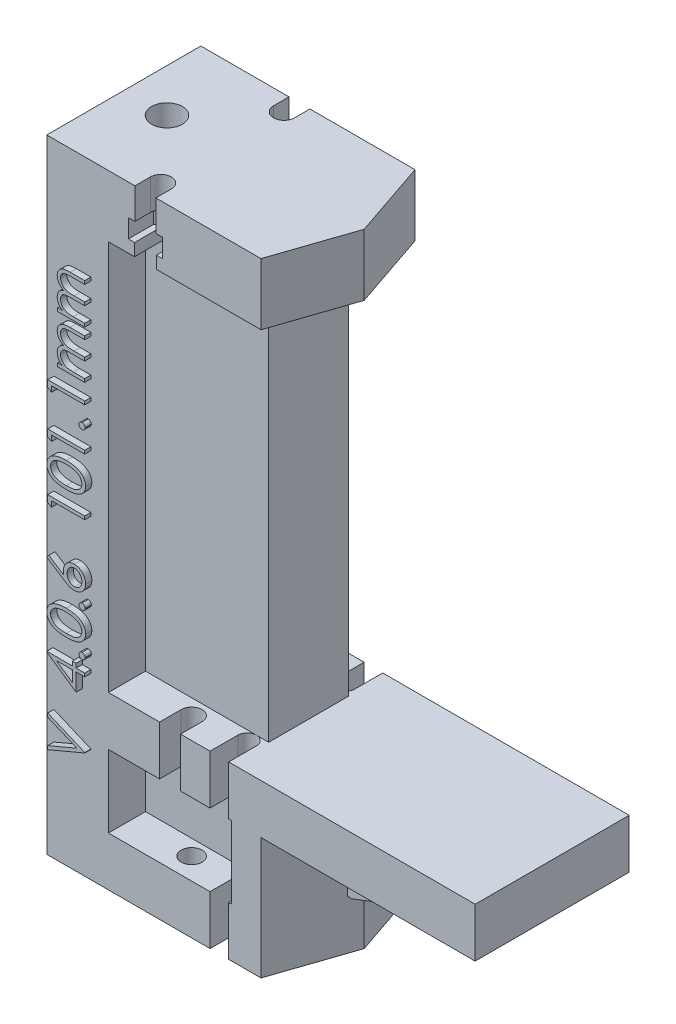
from build123d import *
from build123d.topology import SkipClean

# Parameters (mm, degrees)
BOSS_EXTRUDE2_DEPTH              = 12.5
BOSS_EXTRUDE3_DEPTH              = 25
CUT_EXTRUDE2_REACH               = 106.893
CUT_EXTRUDE3_REACH               = 106.893
CUT_EXTRUDE6_REACH               = 106.893
SKETCH30_W                       = 10
SKETCH30_H                       = 25
CUT_EXTRUDE8_DEPTH               = 8
CUT_EXTRUDE9_DEPTH               = 79.499719904
CUT_EXTRUDE9_DEPTH_BACK          = 79.499719904
BOSS_EXTRUDE6_DEPTH              = 1
BOSS_EXTRUDE7_DEPTH              = 40
BOSS_EXTRUDE17_DEPTH             = 2
CUT_EXTRUDE10_DEPTH              = 3
SKETCH39_W                       = 4
SKETCH39_H                       = 11.745
BOSS_EXTRUDE18_DEPTH             = 2.5
F_5_0MM_DOWEL_HOLE1_D            = 5
F_5_0MM_DOWEL_HOLE1_DEPTH        = 5
F_5_0MM_DOWEL_HOLE1_TIP          = 1.502151548
BOSS_EXTRUDE19_DEPTH             = 2
BOSS_EXTRUDE20_DEPTH             = 8
BOSS_EXTRUDE21_REACH             = 88.858
SKETCH45_W                       = 20
SKETCH45_H                       = 12.98
BOSS_EXTRUDE21_DIRECTION_2_REACH = 88.858


with BuildPart() as part:
    # Sketch6 → Boss-Extrude2 (new, symmetric)
    with BuildSketch(Plane.XY):
        Polygon((-25, 50.55), (15, 50.55), (15, 42.55), (-15, 42.55), (-15, -42.55), (25, -42.55), (25, -50.55), (-25, -50.55), align=None)
    extrude(amount=BOSS_EXTRUDE2_DEPTH, both=True)

    # Sketch15 → Boss-Extrude3 (add)
    with BuildSketch(Plane.XY.offset(12.5)):
        Polygon((-15, -22.805), (15, -22.805), (15, -50.55), (5, -50.55), (5, -30.805), (-15, -30.805), align=None)
    extrude(amount=-BOSS_EXTRUDE3_DEPTH)

    # Sketch20 → Cut-Extrude2 (cut, up to next)
    with BuildSketch(Plane(origin=(0, 50.55, 0), x_dir=(1, 0, 0), z_dir=(0, 1, 0)), mode=Mode.PRIVATE) as cut_extrude2_sk1:
        with BuildLine():
            Line((-10.7, 12.5), (-10.7, 10))
            ThreePointArc((-10.7, 10), (-9, 8.3), (-7.3, 10))
            Line((-7.3, 10), (-7.3, 12.5))
            Line((-7.3, 12.5), (-10.7, 12.5))
        make_face()
    cut_extrude2_tool1 = extrude(cut_extrude2_sk1.sketch, amount=-CUT_EXTRUDE2_REACH, mode=Mode.PRIVATE) & part.part
    # Sketch20 → Cut-Extrude2 (cut, up to next)
    with BuildSketch(Plane(origin=(0, 50.55, 0), x_dir=(1, 0, 0), z_dir=(0, 1, 0)), mode=Mode.PRIVATE) as cut_extrude2_sk2:
        with BuildLine():
            Line((-7.3, -12.5), (-10.7, -12.5))
            Line((-10.7, -12.5), (-10.7, -10))
            ThreePointArc((-10.7, -10), (-9, -8.3), (-7.3, -10))
            Line((-7.3, -10), (-7.3, -12.5))
        make_face()
    cut_extrude2_tool2 = extrude(cut_extrude2_sk2.sketch, amount=-CUT_EXTRUDE2_REACH, mode=Mode.PRIVATE) & part.part
    add(cut_extrude2_tool1.solids().sort_by_distance((-9, 50.55, -10.563642))[0], mode=Mode.SUBTRACT)
    add(cut_extrude2_tool2.solids().sort_by_distance((-9, 50.55, 10.563642))[0], mode=Mode.SUBTRACT)

    # Cut-Extrude3: up to this face of the body (flat: up to its plane)
    cut_extrude3_end = Plane(part.part.faces().sort_by_distance((0, -22.805, 0))[0])
    # Sketch21 → Cut-Extrude3 (cut, up to the picked face)
    with BuildSketch(Plane.XZ.offset(50.55), mode=Mode.PRIVATE) as cut_extrude3_sk1:
        with BuildLine():
            Line((-6.7, 12.5), (-6.7, 9))
            ThreePointArc((-6.7, 9), (-5, 7.3), (-3.3, 9))
            Line((-3.3, 9), (-3.3, 12.5))
            Line((-3.3, 12.5), (-6.7, 12.5))
        make_face()
    cut_extrude3_tool1 = split(extrude(cut_extrude3_sk1.sketch, amount=-CUT_EXTRUDE3_REACH, mode=Mode.PRIVATE), bisect_by=cut_extrude3_end, keep=Keep.BOTH, mode=Mode.PRIVATE)
    # Sketch21 → Cut-Extrude3 (cut, up to the picked face)
    with BuildSketch(Plane.XZ.offset(50.55), mode=Mode.PRIVATE) as cut_extrude3_sk2:
        with BuildLine():
            Line((-3.3, -12.5), (-6.7, -12.5))
            Line((-6.7, -12.5), (-6.7, -9))
            ThreePointArc((-6.7, -9), (-5, -7.3), (-3.3, -9))
            Line((-3.3, -9), (-3.3, -12.5))
        make_face()
    cut_extrude3_tool2 = split(extrude(cut_extrude3_sk2.sketch, amount=-CUT_EXTRUDE3_REACH, mode=Mode.PRIVATE), bisect_by=cut_extrude3_end, keep=Keep.BOTH, mode=Mode.PRIVATE)
    add(cut_extrude3_tool1.solids().sort_by(Axis((-5, -50.55, 10.067524), (0, 1, 0)))[0], mode=Mode.SUBTRACT)
    add(cut_extrude3_tool2.solids().sort_by(Axis((-5, -50.55, -10.067524), (0, 1, 0)))[0], mode=Mode.SUBTRACT)

    # Cut-Extrude6: up to this face of the body (flat: up to its plane)
    cut_extrude6_end = Plane(part.part.faces().sort_by_distance((0.229244521, -22.805, 0))[0])
    # Sketch24 → Cut-Extrude6 (cut, up to the picked face)
    with BuildSketch(Plane.XZ.offset(50.55), mode=Mode.PRIVATE) as cut_extrude6_sk1:
        with BuildLine():
            Line((1.49, -12.5), (1.49, -8))
            ThreePointArc((1.49, -8), (3, -6.49), (4.51, -8))
            Line((4.51, -8), (4.51, -12.5))
            Line((4.51, -12.5), (1.49, -12.5))
        make_face()
    cut_extrude6_tool1 = split(extrude(cut_extrude6_sk1.sketch, amount=-CUT_EXTRUDE6_REACH, mode=Mode.PRIVATE), bisect_by=cut_extrude6_end, keep=Keep.BOTH, mode=Mode.PRIVATE)
    # Sketch24 → Cut-Extrude6 (cut, up to the picked face)
    with BuildSketch(Plane.XZ.offset(50.55), mode=Mode.PRIVATE) as cut_extrude6_sk2:
        with BuildLine():
            Line((4.51, 12.5), (1.49, 12.5))
            Line((1.49, 12.5), (1.49, 8))
            ThreePointArc((1.49, 8), (3, 6.49), (4.51, 8))
            Line((4.51, 8), (4.51, 12.5))
        make_face()
    cut_extrude6_tool2 = split(extrude(cut_extrude6_sk2.sketch, amount=-CUT_EXTRUDE6_REACH, mode=Mode.PRIVATE), bisect_by=cut_extrude6_end, keep=Keep.BOTH, mode=Mode.PRIVATE)
    add(cut_extrude6_tool1.solids().sort_by(Axis((3, -50.55, -9.647036), (0, 1, 0)))[0], mode=Mode.SUBTRACT)
    add(cut_extrude6_tool2.solids().sort_by(Axis((3, -50.55, 9.647036), (0, 1, 0)))[0], mode=Mode.SUBTRACT)

    # Sketch30 → Cut-Extrude8 (cut)
    with BuildSketch(Plane(origin=(0, -42.55, 0), x_dir=(1, 0, 0), z_dir=(0, 1, 0))):
        with Locations((20, 0)):
            Rectangle(SKETCH30_W, SKETCH30_H)
    extrude(amount=-CUT_EXTRUDE8_DEPTH, mode=Mode.SUBTRACT)

    # Sketch34 → Cut-Extrude9 (cut, two sides: drawn at the far end of the back side and taken through both)
    with BuildSketch(Plane(origin=(0, -22.805, 0), x_dir=(1, 0, 0), z_dir=(0, 1, 0)).offset(-CUT_EXTRUDE9_DEPTH_BACK)):
        Polygon((9.755, 12.5), (14, 0), (9.755, -12.5), (15, -12.5), (15, 12.5), align=None)
    extrude(amount=CUT_EXTRUDE9_DEPTH + CUT_EXTRUDE9_DEPTH_BACK, mode=Mode.SUBTRACT)

    # Sketch35 → Boss-Extrude6 (add)
    # profile 1 of 13: a face of its own
    with BuildSketch(Plane.XY.offset(12.5)):
        with BuildLine():
            Line((-22.234615385, 27.615384615), (-22.234615385, 28.153846154))
            Line((-22.234615385, 28.153846154), (-21.472596154, 28.153846154))
            add(Edge.make_bspline(
                [(-21.472596154, 28.153846154), (-21.539260614, 28.202332925), (-21.666996111, 28.295238227), (-21.835322312, 28.447579346), (-21.978170577, 28.599766967), (-22.053158357, 28.70936705), (-22.089182692, 28.762019231)],
                knots=[0, 0, 0, 0, 1.134379233, 2.173579362, 3.122582517, 4, 4, 4, 4], degree=3))
            add(Edge.make_bspline(
                [(-22.089182692, 28.762019231), (-22.123477604, 28.833787223), (-22.191468256, 28.976069337), (-22.260440071, 29.201359437), (-22.302825959, 29.431887442), (-22.308622599, 29.587558666), (-22.311538462, 29.665865385)],
                knots=[0, 0, 0, 0, 1.014936303, 2.012140481, 3.000054389, 4, 4, 4, 4], degree=3))
            add(Edge.make_bspline(
                [(-22.311538462, 29.665865385), (-22.309746507, 29.718824779), (-22.306200324, 29.823628574), (-22.283126386, 29.978915994), (-22.243239974, 30.129529211), (-22.187690322, 30.274587601), (-22.120389321, 30.411230628), (-22.041520642, 30.536600172), (-21.952811526, 30.648610476), (-21.851715073, 30.749056719), (-21.732621113, 30.83858538), (-21.593245652, 30.920361942), (-21.431579845, 30.996927786), (-21.314358593, 31.039096955), (-21.252644231, 31.061298077)],
                knots=[0, 0, 0, 0, 1.009731074, 1.9982035, 2.985760524, 3.974587072, 4.955028184, 5.885388378, 6.793242796, 7.673688873, 8.594941726, 9.625945874, 10.750113716, 12, 12, 12, 12], degree=3))
            add(Edge.make_bspline(
                [(-21.252644231, 31.061298077), (-21.295028488, 31.084803509), (-21.378434755, 31.131058898), (-21.496484081, 31.208719564), (-21.60687165, 31.290115359), (-21.709826129, 31.375808349), (-21.80452798, 31.466158417), (-21.892909205, 31.559709831), (-21.972522012, 31.65855761), (-22.065676161, 31.795282971), (-22.164941217, 31.97298822), (-22.248837086, 32.197914933), (-22.302266055, 32.431002803), (-22.308427236, 32.589456464), (-22.311538462, 32.669471154)],
                knots=[0, 0, 0, 0, 0.861026002, 1.694378253, 2.508904292, 3.297437177, 4.073006284, 4.833627155, 5.583069468, 6.325614666, 7.772320565, 9.187282923, 10.579656144, 12, 12, 12, 12], degree=3))
            add(Edge.make_bspline(
                [(-22.311538462, 32.669471154), (-22.308800813, 32.742995007), (-22.30344297, 32.886888326), (-22.260375554, 33.096018305), (-22.189095041, 33.291888325), (-22.088852441, 33.472422361), (-21.963482389, 33.635522594), (-21.814139706, 33.777834074), (-21.641369838, 33.896227786), (-21.480136821, 33.975377221), (-21.337524673, 34.028068152), (-21.215460368, 34.060975775), (-21.081004779, 34.089485755), (-20.934266049, 34.113657918), (-20.774947077, 34.131133284), (-20.602974661, 34.144124267), (-20.418199364, 34.152904699), (-20.290715767, 34.153525923), (-20.225, 34.153846154)],
                knots=[0, 0, 0, 0, 1.209392158, 2.366897878, 3.497663982, 4.628180075, 5.751982922, 6.871462727, 8.009245026, 9.185977379, 9.818124946, 10.509294143, 11.264649411, 12.079922034, 12.956003306, 13.901808055, 14.918415426, 16, 16, 16, 16], degree=3))
            Line((-20.225, 34.153846154), (-17.85, 34.153846154))
            Line((-17.85, 34.153846154), (-17.85, 33.615384615))
            Line((-17.85, 33.615384615), (-20.227403846, 33.615384615))
            add(Edge.make_bspline(
                [(-20.227403846, 33.615384615), (-20.283496341, 33.61525175), (-20.391297586, 33.614996403), (-20.546014988, 33.610370226), (-20.687050044, 33.60169783), (-20.814586843, 33.591401636), (-20.928585361, 33.577484141), (-21.028726359, 33.559108709), (-21.115466742, 33.539796341), (-21.211587244, 33.507636113), (-21.317531947, 33.456700435), (-21.430954892, 33.377701419), (-21.530458078, 33.279661851), (-21.616841526, 33.165831979), (-21.687129696, 33.036339747), (-21.737313417, 32.893594816), (-21.768382244, 32.738515088), (-21.771478124, 32.631161524), (-21.773076923, 32.575721154)],
                knots=[0, 0, 0, 0, 1.253367865, 2.408782419, 3.458086102, 4.410454771, 5.267690823, 6.022776742, 6.685072793, 7.251272234, 8.28433411, 9.300106008, 10.325693114, 11.39283262, 12.482417211, 13.60372085, 14.762494729, 16, 16, 16, 16], degree=3))
            add(Edge.make_bspline(
                [(-21.773076923, 32.575721154), (-21.76997183, 32.50777098), (-21.763840459, 32.373595416), (-21.717743069, 32.176588739), (-21.641126709, 31.989288216), (-21.536341225, 31.812958398), (-21.407618816, 31.652246316), (-21.255294615, 31.513477382), (-21.082742522, 31.3989302), (-20.92307314, 31.321348132), (-20.779638783, 31.272334455), (-20.654327211, 31.239989762), (-20.511520556, 31.214678274), (-20.352893327, 31.191399346), (-20.177094809, 31.175688837), (-19.985210505, 31.161810327), (-19.775926859, 31.155231794), (-19.63085208, 31.15431971), (-19.555528846, 31.153846154)],
                knots=[0, 0, 0, 0, 1.091136677, 2.154576964, 3.231646693, 4.331257757, 5.439166191, 6.528231045, 7.628049365, 8.756709726, 9.369482423, 10.061167346, 10.833871401, 11.698739631, 12.636505159, 13.668922441, 14.789697963, 16, 16, 16, 16], degree=3))
            Line((-19.555528846, 31.153846154), (-17.85, 31.153846154))
            Line((-17.85, 31.153846154), (-17.85, 30.615384615))
            Line((-17.85, 30.615384615), (-20.079567308, 30.615384615))
            add(Edge.make_bspline(
                [(-20.079567308, 30.615384615), (-20.14247014, 30.615248448), (-20.263488866, 30.614986475), (-20.437032312, 30.610398505), (-20.594885583, 30.601678575), (-20.736865264, 30.591597658), (-20.862713168, 30.577094421), (-20.973104451, 30.56062077), (-21.067760922, 30.54116532), (-21.17158701, 30.508956742), (-21.285945136, 30.459714552), (-21.407983755, 30.380604381), (-21.514604324, 30.281417491), (-21.607034555, 30.166349159), (-21.682563185, 30.035870107), (-21.73505501, 29.891423368), (-21.767080197, 29.735375076), (-21.771040318, 29.627561566), (-21.773076923, 29.572115385)],
                knots=[0, 0, 0, 0, 1.320285835, 2.540097241, 3.643286278, 4.638464947, 5.527188413, 6.301437306, 6.980978976, 7.552872752, 8.580906713, 9.583871393, 10.589652407, 11.624542289, 12.671761011, 13.738681301, 14.837052193, 16, 16, 16, 16], degree=3))
            add(Edge.make_bspline(
                [(-21.773076923, 29.572115385), (-21.770453269, 29.506944753), (-21.765224419, 29.377061998), (-21.718160076, 29.186258376), (-21.644438314, 29.001998159), (-21.542166243, 28.827214974), (-21.415474903, 28.666644721), (-21.266504635, 28.526007243), (-21.097243672, 28.408221402), (-20.939930706, 28.329292274), (-20.800047184, 28.278690912), (-20.680645905, 28.245515012), (-20.548314964, 28.216395158), (-20.402780158, 28.194994017), (-20.24469108, 28.174269247), (-20.073236398, 28.164279089), (-19.888570334, 28.154555048), (-19.761074488, 28.154088248), (-19.694951923, 28.153846154)],
                knots=[0, 0, 0, 0, 1.09880202, 2.189873405, 3.297736452, 4.440485332, 5.596193377, 6.739822772, 7.886349079, 9.066114917, 9.699498033, 10.395421758, 11.156987371, 11.985484089, 12.878178647, 13.847820956, 14.883825601, 16, 16, 16, 16], degree=3))
            Line((-19.694951923, 28.153846154), (-17.85, 28.153846154))
            Line((-17.85, 28.153846154), (-17.85, 27.615384615))
            Line((-17.85, 27.615384615), (-22.234615385, 27.615384615))
        make_face()
    # profile 2 of 13: a face of its own
    with BuildSketch(Plane.XY.offset(12.5)):
        with BuildLine():
            Line((-22.234615385, 19.846153846), (-22.234615385, 20.384615385))
            Line((-22.234615385, 20.384615385), (-21.472596154, 20.384615385))
            add(Edge.make_bspline(
                [(-21.472596154, 20.384615385), (-21.539260614, 20.433102156), (-21.666996111, 20.526007458), (-21.835322312, 20.678348577), (-21.978170577, 20.830536198), (-22.053158357, 20.940136281), (-22.089182692, 20.992788462)],
                knots=[0, 0, 0, 0, 1.134379233, 2.173579362, 3.122582517, 4, 4, 4, 4], degree=3))
            add(Edge.make_bspline(
                [(-22.089182692, 20.992788462), (-22.123477604, 21.064556454), (-22.191468256, 21.206838568), (-22.260440071, 21.432128668), (-22.302825959, 21.662656672), (-22.308622599, 21.818327896), (-22.311538462, 21.896634615)],
                knots=[0, 0, 0, 0, 1.014936303, 2.012140481, 3.000054389, 4, 4, 4, 4], degree=3))
            add(Edge.make_bspline(
                [(-22.311538462, 21.896634615), (-22.309746507, 21.94959401), (-22.306200324, 22.054397804), (-22.283126386, 22.209685225), (-22.243239974, 22.360298442), (-22.187690322, 22.505356831), (-22.120389321, 22.641999859), (-22.041520642, 22.767369402), (-21.952811526, 22.879379707), (-21.851715073, 22.97982595), (-21.732621113, 23.069354611), (-21.593245652, 23.151131173), (-21.431579845, 23.227697017), (-21.314358593, 23.269866186), (-21.252644231, 23.292067308)],
                knots=[0, 0, 0, 0, 1.009731074, 1.9982035, 2.985760524, 3.974587072, 4.955028184, 5.885388378, 6.793242796, 7.673688873, 8.594941726, 9.625945874, 10.750113716, 12, 12, 12, 12], degree=3))
            add(Edge.make_bspline(
                [(-21.252644231, 23.292067308), (-21.295028488, 23.31557274), (-21.378434755, 23.361828129), (-21.496484081, 23.439488795), (-21.60687165, 23.52088459), (-21.709826129, 23.60657758), (-21.80452798, 23.696927648), (-21.892909205, 23.790479062), (-21.972522012, 23.889326841), (-22.065676161, 24.026052201), (-22.164941217, 24.20375745), (-22.248837086, 24.428684164), (-22.302266055, 24.661772034), (-22.308427236, 24.820225695), (-22.311538462, 24.900240385)],
                knots=[0, 0, 0, 0, 0.861026002, 1.694378253, 2.508904292, 3.297437177, 4.073006284, 4.833627155, 5.583069468, 6.325614666, 7.772320565, 9.187282923, 10.579656144, 12, 12, 12, 12], degree=3))
            add(Edge.make_bspline(
                [(-22.311538462, 24.900240385), (-22.308800813, 24.973764238), (-22.30344297, 25.117657557), (-22.260375554, 25.326787536), (-22.189095041, 25.522657555), (-22.088852441, 25.703191592), (-21.963482389, 25.866291825), (-21.814139706, 26.008603304), (-21.641369838, 26.126997017), (-21.480136821, 26.206146451), (-21.337524673, 26.258837383), (-21.215460368, 26.291745005), (-21.081004779, 26.320254985), (-20.934266049, 26.344427149), (-20.774947077, 26.361902515), (-20.602974661, 26.374893498), (-20.418199364, 26.38367393), (-20.290715767, 26.384295154), (-20.225, 26.384615385)],
                knots=[0, 0, 0, 0, 1.209392158, 2.366897878, 3.497663982, 4.628180075, 5.751982922, 6.871462727, 8.009245026, 9.185977379, 9.818124946, 10.509294143, 11.264649411, 12.079922034, 12.956003306, 13.901808055, 14.918415426, 16, 16, 16, 16], degree=3))
            Line((-20.225, 26.384615385), (-17.85, 26.384615385))
            Line((-17.85, 26.384615385), (-17.85, 25.846153846))
            Line((-17.85, 25.846153846), (-20.227403846, 25.846153846))
            add(Edge.make_bspline(
                [(-20.227403846, 25.846153846), (-20.283496341, 25.846020981), (-20.391297586, 25.845765633), (-20.546014988, 25.841139457), (-20.687050044, 25.832467061), (-20.814586843, 25.822170867), (-20.928585361, 25.808253372), (-21.028726359, 25.78987794), (-21.115466742, 25.770565572), (-21.211587244, 25.738405344), (-21.317531947, 25.687469666), (-21.430954892, 25.608470649), (-21.530458078, 25.510431082), (-21.616841526, 25.396601209), (-21.687129696, 25.267108977), (-21.737313417, 25.124364047), (-21.768382244, 24.969284319), (-21.771478124, 24.861930754), (-21.773076923, 24.806490385)],
                knots=[0, 0, 0, 0, 1.253367865, 2.408782419, 3.458086102, 4.410454771, 5.267690823, 6.022776742, 6.685072793, 7.251272234, 8.28433411, 9.300106008, 10.325693114, 11.39283262, 12.482417211, 13.60372085, 14.762494729, 16, 16, 16, 16], degree=3))
            add(Edge.make_bspline(
                [(-21.773076923, 24.806490385), (-21.76997183, 24.738540211), (-21.763840459, 24.604364647), (-21.717743069, 24.40735797), (-21.641126709, 24.220057447), (-21.536341225, 24.043727629), (-21.407618816, 23.883015547), (-21.255294615, 23.744246613), (-21.082742522, 23.62969943), (-20.92307314, 23.552117362), (-20.779638783, 23.503103686), (-20.654327211, 23.470758993), (-20.511520556, 23.445447505), (-20.352893327, 23.422168577), (-20.177094809, 23.406458068), (-19.985210505, 23.392579558), (-19.775926859, 23.386001025), (-19.63085208, 23.385088941), (-19.555528846, 23.384615385)],
                knots=[0, 0, 0, 0, 1.091136677, 2.154576964, 3.231646693, 4.331257757, 5.439166191, 6.528231045, 7.628049365, 8.756709726, 9.369482423, 10.061167346, 10.833871401, 11.698739631, 12.636505159, 13.668922441, 14.789697963, 16, 16, 16, 16], degree=3))
            Line((-19.555528846, 23.384615385), (-17.85, 23.384615385))
            Line((-17.85, 23.384615385), (-17.85, 22.846153846))
            Line((-17.85, 22.846153846), (-20.079567308, 22.846153846))
            add(Edge.make_bspline(
                [(-20.079567308, 22.846153846), (-20.14247014, 22.846017679), (-20.263488866, 22.845755706), (-20.437032312, 22.841167736), (-20.594885583, 22.832447805), (-20.736865264, 22.822366889), (-20.862713168, 22.807863652), (-20.973104451, 22.791390001), (-21.067760922, 22.771934551), (-21.17158701, 22.739725972), (-21.285945136, 22.690483782), (-21.407983755, 22.611373611), (-21.514604324, 22.512186722), (-21.607034555, 22.39711839), (-21.682563185, 22.266639338), (-21.73505501, 22.122192599), (-21.767080197, 21.966144307), (-21.771040318, 21.858330796), (-21.773076923, 21.802884615)],
                knots=[0, 0, 0, 0, 1.320285835, 2.540097241, 3.643286278, 4.638464947, 5.527188413, 6.301437306, 6.980978976, 7.552872752, 8.580906713, 9.583871393, 10.589652407, 11.624542289, 12.671761011, 13.738681301, 14.837052193, 16, 16, 16, 16], degree=3))
            add(Edge.make_bspline(
                [(-21.773076923, 21.802884615), (-21.770453269, 21.737713984), (-21.765224419, 21.607831229), (-21.718160076, 21.417027607), (-21.644438314, 21.232767389), (-21.542166243, 21.057984205), (-21.415474903, 20.897413952), (-21.266504635, 20.756776474), (-21.097243672, 20.638990632), (-20.939930706, 20.560061505), (-20.800047184, 20.509460143), (-20.680645905, 20.476284243), (-20.548314964, 20.447164389), (-20.402780158, 20.425763248), (-20.24469108, 20.405038478), (-20.073236398, 20.39504832), (-19.888570334, 20.385324279), (-19.761074488, 20.384857479), (-19.694951923, 20.384615385)],
                knots=[0, 0, 0, 0, 1.09880202, 2.189873405, 3.297736452, 4.440485332, 5.596193377, 6.739822772, 7.886349079, 9.066114917, 9.699498033, 10.395421758, 11.156987371, 11.985484089, 12.878178647, 13.847820956, 14.883825601, 16, 16, 16, 16], degree=3))
            Line((-19.694951923, 20.384615385), (-17.85, 20.384615385))
            Line((-17.85, 20.384615385), (-17.85, 19.846153846))
            Line((-17.85, 19.846153846), (-22.234615385, 19.846153846))
        make_face()
    # profile 3 of 13: a face of its own
    with BuildSketch(Plane.XY.offset(12.5)):
        Polygon((-23.85, 16.121394231), (-23.85, 17.230769231), (-17.85, 17.230769231), (-17.85, 16.692307692), (-23.234615385, 16.692307692), (-23.234615385, 15.769230769), align=None)
    # profile 4 of 13: a face of its own
    with BuildSketch(Plane.XY.offset(12.5)):
        with BuildLine():
            add(Edge.make_bspline(
                [(-18.773076923, 13.5), (-18.771091494, 13.533411792), (-18.767199294, 13.598911705), (-18.740496425, 13.693607354), (-18.693081578, 13.779312484), (-18.629888244, 13.855653476), (-18.553267107, 13.918578864), (-18.468245549, 13.967683467), (-18.372757105, 13.994153728), (-18.306877662, 13.998017577), (-18.273076923, 14)],
                knots=[0, 0, 0, 0, 1.020151414, 1.999887582, 2.974338812, 3.990962822, 5.007586832, 5.987933904, 6.967670073, 8, 8, 8, 8], degree=3))
            add(Edge.make_bspline(
                [(-18.273076923, 14), (-18.240082695, 13.997956712), (-18.17501856, 13.993927377), (-18.080332316, 13.967671525), (-17.995213248, 13.918638474), (-17.918771705, 13.855253112), (-17.854052036, 13.779769027), (-17.807265803, 13.693339216), (-17.778559122, 13.599151168), (-17.774926676, 13.53345467), (-17.773076923, 13.5)],
                knots=[0, 0, 0, 0, 1.009624703, 1.990965087, 2.972917375, 3.991206001, 5.017354006, 5.993400798, 6.978178195, 8, 8, 8, 8], degree=3))
            add(Edge.make_bspline(
                [(-17.773076923, 13.5), (-17.774859529, 13.466521236), (-17.778339643, 13.40116192), (-17.807852551, 13.307325026), (-17.853605582, 13.220368422), (-17.918889524, 13.144903952), (-17.994817845, 13.081004939), (-18.080918523, 13.034147269), (-18.174747202, 13.005614924), (-18.240029244, 13.001887122), (-18.273076923, 13)],
                knots=[0, 0, 0, 0, 1.022258411, 1.995716197, 2.98297171, 4.009558169, 5.028281891, 6.00474573, 6.989943903, 8, 8, 8, 8], degree=3))
            add(Edge.make_bspline(
                [(-18.273076923, 13), (-18.306933002, 13.001820742), (-18.373032842, 13.005375516), (-18.467659884, 13.034133791), (-18.553662923, 13.08106444), (-18.629771346, 13.14450226), (-18.693521007, 13.220829624), (-18.739917796, 13.30705169), (-18.767415645, 13.401405188), (-18.771157102, 13.466565082), (-18.773076923, 13.5)],
                knots=[0, 0, 0, 0, 1.032775665, 2.016367738, 2.991239715, 4.008302682, 5.025365648, 6.011011707, 6.979408107, 8, 8, 8, 8], degree=3))
        make_face()
    # profile 5 of 13: a face of its own
    with BuildSketch(Plane.XY.offset(12.5)):
        Polygon((-23.85, 9.198317308), (-23.85, 10.307692308), (-17.85, 10.307692308), (-17.85, 9.769230769), (-23.234615385, 9.769230769), (-23.234615385, 8.846153846), align=None)
    # profile 6 of 13: a face of its own
    with BuildSketch(Plane.XY.offset(12.5)):
        with BuildLine():
            add(Edge.make_bspline(
                [(-20.847596154, 3.307692308), (-20.943763104, 3.308254625), (-21.130568792, 3.309346933), (-21.402771035, 3.321498512), (-21.658131531, 3.341684813), (-21.8966625, 3.369348882), (-22.118425529, 3.403013987), (-22.322827956, 3.447954834), (-22.5108159, 3.499062452), (-22.683002111, 3.558295363), (-22.841707287, 3.625131068), (-22.989862864, 3.697877295), (-23.12725581, 3.779410631), (-23.256039225, 3.865107901), (-23.374246225, 3.958305288), (-23.483238776, 4.057004464), (-23.582097725, 4.163179426), (-23.67089077, 4.275800373), (-23.748749314, 4.394104021), (-23.817752138, 4.514857575), (-23.874589397, 4.64021863), (-23.921083839, 4.76853688), (-23.959038325, 4.900082771), (-23.985109169, 5.03482272), (-24.001483733, 5.173069065), (-24.003051209, 5.266379549), (-24.003846154, 5.313701923)],
                knots=[0, 0, 0, 0, 1.646148282, 3.197666765, 4.66315463, 6.030252048, 7.307778049, 8.501004361, 9.610818041, 10.641065266, 11.615491391, 12.557119604, 13.464013759, 14.348536654, 15.203310953, 16.038349431, 16.863300206, 17.683791446, 18.490318933, 19.285717724, 20.06220424, 20.843281102, 21.620494212, 22.403315558, 23.190242141, 24, 24, 24, 24], degree=3))
            add(Edge.make_bspline(
                [(-24.003846154, 5.313701923), (-24.003184011, 5.361443028), (-24.00186658, 5.456431023), (-23.983322948, 5.596359849), (-23.959388145, 5.733851353), (-23.921000663, 5.866819518), (-23.875065063, 5.997778517), (-23.814453767, 6.12347166), (-23.748534277, 6.248336583), (-23.668118043, 6.366700838), (-23.579244872, 6.482100932), (-23.478351101, 6.590276472), (-23.368228979, 6.693992714), (-23.246422458, 6.789332334), (-23.114799194, 6.880381458), (-22.972255805, 6.963683769), (-22.819108188, 7.040971802), (-22.656066311, 7.113698368), (-22.478775073, 7.177295829), (-22.288340287, 7.233839056), (-22.083037474, 7.280185797), (-21.8640103, 7.318513738), (-21.630173709, 7.348263516), (-21.382001479, 7.369914901), (-21.119338352, 7.381355776), (-20.939753411, 7.383509938), (-20.847596154, 7.384615385)],
                knots=[0, 0, 0, 0, 0.810910589, 1.61342667, 2.396193133, 3.181089899, 3.963115317, 4.752255436, 5.550715454, 6.36105385, 7.181178335, 8.024612154, 8.872680183, 9.750181803, 10.651284446, 11.591556747, 12.554036451, 13.566402641, 14.62422919, 15.753422176, 16.94128843, 18.199818041, 19.531985927, 20.947085226, 22.433341622, 24, 24, 24, 24], degree=3))
            add(Edge.make_bspline(
                [(-20.847596154, 7.384615385), (-20.755841687, 7.383485617), (-20.576661658, 7.381279384), (-20.315168068, 7.370160276), (-20.06833354, 7.347734672), (-19.835894914, 7.320092294), (-19.61774442, 7.281335965), (-19.414024206, 7.234637795), (-19.22401301, 7.181432174), (-19.049072236, 7.116858663), (-18.886313286, 7.045824867), (-18.734291753, 6.96861977), (-18.591786008, 6.885787548), (-18.459815568, 6.796103949), (-18.338497958, 6.699196089), (-18.227998136, 6.595552543), (-18.126462639, 6.486432504), (-18.036610349, 6.370359647), (-17.955581867, 6.250892902), (-17.887270195, 6.126015294), (-17.828082139, 5.998922777), (-17.779690445, 5.868346453), (-17.74216212, 5.734487925), (-17.716363441, 5.596902184), (-17.698228951, 5.456411277), (-17.696847943, 5.361436423), (-17.696153846, 5.313701923)],
                knots=[0, 0, 0, 0, 1.561645053, 3.049612875, 4.452756685, 5.778837748, 7.032101753, 8.221335837, 9.334924186, 10.387562255, 11.392109817, 12.355697819, 13.287721948, 14.19548756, 15.068665045, 15.927346723, 16.771751757, 17.602390507, 18.423119567, 19.225778204, 20.022010933, 20.807278863, 21.593079439, 22.384715467, 23.188155646, 24, 24, 24, 24], degree=3))
            add(Edge.make_bspline(
                [(-17.696153846, 5.313701923), (-17.696953313, 5.266380585), (-17.698529705, 5.173072142), (-17.714838958, 5.034810841), (-17.741059822, 4.900612368), (-17.777773997, 4.769814499), (-17.82271373, 4.641746208), (-17.88126285, 4.518152496), (-17.948692879, 4.397659616), (-18.025484279, 4.280587265), (-18.113467177, 4.169142095), (-18.210766452, 4.062671154), (-18.319877187, 3.963947639), (-18.439081549, 3.871558356), (-18.568056572, 3.784955113), (-18.706888809, 3.704126332), (-18.855815319, 3.629854561), (-19.015774756, 3.56187698), (-19.189183067, 3.501607269), (-19.377650209, 3.448575809), (-19.583090447, 3.40622121), (-19.80446072, 3.37031914), (-20.042210834, 3.341550341), (-20.296426807, 3.321506894), (-20.566625901, 3.309356158), (-20.752230327, 3.308257045), (-20.847596154, 3.307692308)],
                knots=[0, 0, 0, 0, 0.810927267, 1.598990287, 2.382942141, 3.152806972, 3.926217614, 4.706701772, 5.493896336, 6.292070767, 7.104102563, 7.925577746, 8.761822141, 9.623241997, 10.509042271, 11.423174113, 12.375371989, 13.360203808, 14.400680605, 15.520553799, 16.714061498, 17.994519714, 19.364400916, 20.818312473, 22.365209998, 24, 24, 24, 24], degree=3))
        make_face()
        with BuildLine():
            add(Edge.make_bspline(
                [(-20.85, 3.846153846), (-20.769859694, 3.846363103), (-20.614323096, 3.846769228), (-20.388701112, 3.857071927), (-20.177909913, 3.871412233), (-19.982031768, 3.889453163), (-19.801751265, 3.916472021), (-19.636318913, 3.947126567), (-19.486040925, 3.983894824), (-19.349604048, 4.027612784), (-19.225076282, 4.077411794), (-19.109138521, 4.131688098), (-19.000416685, 4.190512961), (-18.899174551, 4.255092167), (-18.806649691, 4.326702492), (-18.720496813, 4.402024071), (-18.643712237, 4.484450102), (-18.551605787, 4.598451448), (-18.456431673, 4.748962083), (-18.373552195, 4.938596427), (-18.321468101, 5.13345681), (-18.314844504, 5.265716072), (-18.311538462, 5.331730769)],
                knots=[0, 0, 0, 0, 1.459098681, 2.831824031, 4.11146945, 5.306290378, 6.412266529, 7.42953815, 8.369053297, 9.227277979, 10.03601793, 10.809473603, 11.557037441, 12.285528272, 12.993193355, 13.685654407, 14.36688038, 15.041354379, 16.352855396, 17.594313975, 18.799247529, 20, 20, 20, 20], degree=3))
            add(Edge.make_bspline(
                [(-18.311538462, 5.331730769), (-18.314433297, 5.3981276), (-18.320212699, 5.530685739), (-18.370653042, 5.725367123), (-18.452653022, 5.9128011), (-18.546336056, 6.060722008), (-18.636124672, 6.17294532), (-18.712589838, 6.25338114), (-18.798233217, 6.327199934), (-18.89063069, 6.397215436), (-18.991555316, 6.461430851), (-19.100519627, 6.519824842), (-19.217826818, 6.573110569), (-19.299717795, 6.603468935), (-19.341586538, 6.618990385)],
                knots=[0, 0, 0, 0, 1.353621445, 2.702441307, 4.075953605, 5.516772412, 6.261413105, 7.007624062, 7.778524365, 8.566925914, 9.372323995, 10.217594641, 11.088702136, 12, 12, 12, 12], degree=3))
            add(Edge.make_bspline(
                [(-19.341586538, 6.618990385), (-19.395123235, 6.637079129), (-19.503825688, 6.673807039), (-19.672449091, 6.721141509), (-19.849368115, 6.758419336), (-20.033525458, 6.791956535), (-20.226279231, 6.814847488), (-20.427033032, 6.83327231), (-20.635938225, 6.844124917), (-20.777872495, 6.845470204), (-20.85, 6.846153846)],
                knots=[0, 0, 0, 0, 0.884706709, 1.796334032, 2.740027952, 3.714592787, 4.726048262, 5.777819803, 6.87074269, 8, 8, 8, 8], degree=3))
            add(Edge.make_bspline(
                [(-20.85, 6.846153846), (-20.922115839, 6.845210665), (-21.063189835, 6.8433656), (-21.269792431, 6.836313049), (-21.466022878, 6.818101208), (-21.652726545, 6.797874146), (-21.828869925, 6.768050342), (-21.995927577, 6.735894088), (-22.151829954, 6.692692057), (-22.299017639, 6.646543708), (-22.435819346, 6.593726455), (-22.562869531, 6.535583233), (-22.680793265, 6.473495653), (-22.789226195, 6.406027824), (-22.888797281, 6.334119505), (-22.977215398, 6.255192469), (-23.058781601, 6.174259166), (-23.150223336, 6.059154948), (-23.244194815, 5.90968862), (-23.328320624, 5.722419092), (-23.378108547, 5.528603204), (-23.38501303, 5.397307597), (-23.388461538, 5.331730769)],
                knots=[0, 0, 0, 0, 1.313483664, 2.569454835, 3.763100662, 4.901599063, 5.988328865, 7.015709358, 7.99797933, 8.932480776, 9.824041341, 10.666387587, 11.475829342, 12.24921787, 12.990555181, 13.709176526, 14.405678811, 15.080244297, 16.38186033, 17.610124501, 18.806354173, 20, 20, 20, 20], degree=3))
            add(Edge.make_bspline(
                [(-23.388461538, 5.331730769), (-23.38500445, 5.265359674), (-23.378083976, 5.13249657), (-23.328550878, 4.936610909), (-23.24444095, 4.748076263), (-23.150404383, 4.59811705), (-23.059132198, 4.484411155), (-22.981449059, 4.403722786), (-22.897353903, 4.327356599), (-22.804008242, 4.257600615), (-22.703122835, 4.193404346), (-22.595806963, 4.132306111), (-22.479652573, 4.078755625), (-22.355222453, 4.028796737), (-22.218778072, 3.985005857), (-22.067956326, 3.948657718), (-21.90212891, 3.915567035), (-21.720531175, 3.89173635), (-21.524611224, 3.87075185), (-21.313280962, 3.857229358), (-21.086884212, 3.846722031), (-20.930542894, 3.846347035), (-20.85, 3.846153846)],
                knots=[0, 0, 0, 0, 1.207546505, 2.417292871, 3.651582144, 4.952510111, 5.626719005, 6.30238548, 6.989136872, 7.692112372, 8.420316868, 9.164734959, 9.937886623, 10.746308695, 11.604196049, 12.543341915, 13.568754172, 14.680483261, 15.875568977, 17.154711427, 18.534182925, 20, 20, 20, 20], degree=3))
        make_face(mode=Mode.SUBTRACT)
    # profile 7 of 13: a face of its own
    with BuildSketch(Plane.XY.offset(12.5)):
        Polygon((-23.85, -0.032451923), (-23.85, 1.076923077), (-17.85, 1.076923077), (-17.85, 0.538461538), (-23.234615385, 0.538461538), (-23.234615385, -0.384615385), align=None)
    # profile 8 of 13: a face of its own
    with BuildSketch(Plane.XY.offset(12.5)):
        with BuildLine():
            Line((-24.003846154, -7.769230769), (-23.678125, -7.354567308))
            Line((-23.678125, -7.354567308), (-21.253846154, -8.939903846))
            add(Edge.make_bspline(
                [(-21.253846154, -8.939903846), (-21.270669915, -8.8343548), (-21.303486563, -8.628469451), (-21.308900184, -8.420070768), (-21.311538462, -8.318509615)],
                knots=[0, 0, 0, 0, 1.025318673, 2, 2, 2, 2], degree=3))
            add(Edge.make_bspline(
                [(-21.311538462, -8.318509615), (-21.309899413, -8.257528193), (-21.306672995, -8.137488078), (-21.281843536, -7.961247847), (-21.242714775, -7.791895379), (-21.185676611, -7.630132639), (-21.112815472, -7.475378866), (-21.025491544, -7.326746526), (-20.919196668, -7.187027497), (-20.800454525, -7.054430475), (-20.668947951, -6.934022555), (-20.529372943, -6.827502337), (-20.381740538, -6.737537115), (-20.226083938, -6.665861323), (-20.063621598, -6.608579672), (-19.893719906, -6.567802109), (-19.716092105, -6.543424667), (-19.595268777, -6.540133401), (-19.533894231, -6.538461538)],
                knots=[0, 0, 0, 0, 1.043709831, 2.054511743, 3.041122595, 4.01515914, 4.98481438, 5.965901842, 6.960491961, 7.985277438, 9.0096037, 10.00832444, 10.987059228, 11.962929573, 12.936966118, 13.931840027, 14.949438142, 16, 16, 16, 16], degree=3))
            add(Edge.make_bspline(
                [(-19.533894231, -6.538461538), (-19.449925882, -6.540895218), (-19.284696042, -6.545684123), (-19.044095149, -6.593603898), (-18.815016278, -6.667510719), (-18.601423329, -6.774839518), (-18.401836938, -6.905627174), (-18.225572893, -7.067080433), (-18.068373459, -7.251188877), (-17.936976256, -7.459474344), (-17.829652901, -7.683599065), (-17.752570648, -7.919061244), (-17.705113004, -8.163564499), (-17.699163435, -8.329515314), (-17.696153846, -8.413461538)],
                knots=[0, 0, 0, 0, 1.031403119, 2.029557249, 3.004870281, 3.983165322, 4.960181699, 5.929903783, 6.912123683, 7.928973898, 8.949315281, 9.960468141, 10.968302741, 12, 12, 12, 12], degree=3))
            add(Edge.make_bspline(
                [(-17.696153846, -8.413461538), (-17.698766183, -8.494202138), (-17.703940764, -8.654135128), (-17.750276973, -8.889341646), (-17.824845886, -9.115746657), (-17.929732025, -9.330443938), (-18.059978665, -9.529658637), (-18.215685436, -9.709310241), (-18.397068655, -9.864583946), (-18.600160456, -9.994967124), (-18.818092402, -10.098817297), (-19.045725188, -10.175968391), (-19.282103161, -10.221271814), (-19.44235951, -10.227587943), (-19.523076923, -10.230769231)],
                knots=[0, 0, 0, 0, 1.012172929, 2.004937354, 2.995255351, 3.995689452, 4.993936421, 5.973737378, 6.968231049, 7.979117505, 8.993136101, 9.989812463, 10.987515067, 12, 12, 12, 12], degree=3))
            add(Edge.make_bspline(
                [(-19.523076923, -10.230769231), (-19.584867637, -10.228743896), (-19.711032469, -10.224608551), (-19.90211366, -10.195734167), (-20.0976298, -10.149337376), (-20.263494132, -10.097376954), (-20.399371027, -10.042475908), (-20.508919868, -9.99678584), (-20.621653136, -9.939916133), (-20.741436512, -9.879276051), (-20.865182968, -9.809407133), (-20.994960687, -9.733437448), (-21.128705706, -9.649266618), (-21.219467184, -9.590260625), (-21.265865385, -9.560096154)],
                knots=[0, 0, 0, 0, 1.173818275, 2.396712641, 3.66331629, 4.989737886, 5.693666774, 6.447286557, 7.243889047, 8.091586357, 8.998013824, 9.943181721, 10.948533338, 12, 12, 12, 12], degree=3))
            Line((-21.265865385, -9.560096154), (-24.003846154, -7.769230769))
        make_face()
        with BuildLine():
            add(Edge.make_bspline(
                [(-20.696153846, -8.431490385), (-20.694832934, -8.477201543), (-20.692252808, -8.566488714), (-20.67694369, -8.697410568), (-20.649079349, -8.821721576), (-20.610443012, -8.939457821), (-20.562808931, -9.051345615), (-20.501690222, -9.15516765), (-20.430500874, -9.25306035), (-20.349369676, -9.343459645), (-20.260601819, -9.425441035), (-20.165508182, -9.496036003), (-20.066398904, -9.556931872), (-19.962441082, -9.606443475), (-19.85367571, -9.644997914), (-19.740602696, -9.672886338), (-19.622463889, -9.688407056), (-19.542351027, -9.690989167), (-19.501442308, -9.692307692)],
                knots=[0, 0, 0, 0, 1.129656352, 2.206547016, 3.251334079, 4.271920891, 5.265058649, 6.249872215, 7.241923875, 8.251504132, 9.246416584, 10.222533834, 11.173322129, 12.116503788, 13.062124155, 14.020151864, 14.989013135, 16, 16, 16, 16], degree=3))
            add(Edge.make_bspline(
                [(-19.501442308, -9.692307692), (-19.460906568, -9.691195906), (-19.381025922, -9.689004994), (-19.263769289, -9.67035158), (-19.151188433, -9.640536045), (-19.043706454, -9.597465494), (-18.939259979, -9.545126196), (-18.841109444, -9.477944678), (-18.746075545, -9.400839814), (-18.658573873, -9.310812841), (-18.577340886, -9.213458046), (-18.506043773, -9.109664028), (-18.44575467, -9.000993579), (-18.395798488, -8.887759678), (-18.359023612, -8.768562611), (-18.330870445, -8.645337836), (-18.315478724, -8.516409969), (-18.312869121, -8.429123512), (-18.311538462, -8.384615385)],
                knots=[0, 0, 0, 0, 0.989367052, 1.949669134, 2.891858276, 3.827522767, 4.772653562, 5.738670152, 6.725809442, 7.756636004, 8.798867547, 9.819240912, 10.826537776, 11.829883227, 12.835515726, 13.868058748, 14.912904531, 16, 16, 16, 16], degree=3))
            add(Edge.make_bspline(
                [(-18.311538462, -8.384615385), (-18.312869225, -8.34010733), (-18.315479031, -8.252821016), (-18.330869278, -8.123892111), (-18.359027885, -8.00067117), (-18.395783003, -7.88146018), (-18.445812463, -7.768277914), (-18.505666483, -7.659702454), (-18.577778041, -7.556890102), (-18.658434397, -7.45947195), (-18.746575547, -7.369819116), (-18.840253141, -7.290900827), (-18.940045333, -7.225818205), (-19.043295772, -7.17140369), (-19.151252632, -7.128810039), (-19.263751768, -7.098847717), (-19.381030493, -7.080233986), (-19.460908107, -7.078037628), (-19.501442308, -7.076923077)],
                knots=[0, 0, 0, 0, 1.087281468, 2.132306021, 3.165025708, 4.170830268, 5.174347389, 6.181816599, 7.194310624, 8.23672049, 9.267723423, 10.261267456, 11.222032883, 12.171822355, 13.107646935, 14.049997283, 15.01046367, 16, 16, 16, 16], degree=3))
            add(Edge.make_bspline(
                [(-19.501442308, -7.076923077), (-19.542404395, -7.077866436), (-19.622799652, -7.079717944), (-19.74054985, -7.100659571), (-19.854250218, -7.129703635), (-19.963186077, -7.173560281), (-20.066927872, -7.230537134), (-20.165998396, -7.299937572), (-20.261162096, -7.380220755), (-20.349543383, -7.472964162), (-20.430412917, -7.57390073), (-20.501592315, -7.681308111), (-20.56235134, -7.793227795), (-20.610295021, -7.911236334), (-20.648918996, -8.033745934), (-20.676844343, -8.16160254), (-20.692212901, -8.294897087), (-20.694823466, -8.385379352), (-20.696153846, -8.431490385)],
                knots=[0, 0, 0, 0, 0.978259475, 1.920005202, 2.851759169, 3.7803069, 4.719124913, 5.675758531, 6.668034766, 7.691045932, 8.733780038, 9.756656648, 10.768121246, 11.773215211, 12.79725739, 13.836288844, 14.897342417, 16, 16, 16, 16], degree=3))
        make_face(mode=Mode.SUBTRACT)
    # profile 9 of 13: a face of its own
    with BuildSketch(Plane.XY.offset(12.5)):
        with BuildLine():
            add(Edge.make_bspline(
                [(-18.773076923, -11.884615385), (-18.771091494, -11.851203592), (-18.767199294, -11.78570368), (-18.740496425, -11.691008031), (-18.693081578, -11.6053029), (-18.629888244, -11.528961909), (-18.553267107, -11.466036521), (-18.468245549, -11.416931917), (-18.372757105, -11.390461657), (-18.306877662, -11.386597808), (-18.273076923, -11.384615385)],
                knots=[0, 0, 0, 0, 1.020151414, 1.999887582, 2.974338812, 3.990962822, 5.007586832, 5.987933904, 6.967670073, 8, 8, 8, 8], degree=3))
            add(Edge.make_bspline(
                [(-18.273076923, -11.384615385), (-18.240082695, -11.386658673), (-18.17501856, -11.390688008), (-18.080332316, -11.41694386), (-17.995213248, -11.465976911), (-17.918771705, -11.529362272), (-17.854052036, -11.604846357), (-17.807265803, -11.691276168), (-17.778559122, -11.785464217), (-17.774926676, -11.851160715), (-17.773076923, -11.884615385)],
                knots=[0, 0, 0, 0, 1.009624703, 1.990965087, 2.972917375, 3.991206001, 5.017354006, 5.993400798, 6.978178195, 8, 8, 8, 8], degree=3))
            add(Edge.make_bspline(
                [(-17.773076923, -11.884615385), (-17.774859529, -11.918094148), (-17.778339643, -11.983453465), (-17.807852551, -12.077290359), (-17.853605582, -12.164246963), (-17.918889524, -12.239711432), (-17.994817845, -12.303610445), (-18.080918523, -12.350468116), (-18.174747202, -12.379000461), (-18.240029244, -12.382728262), (-18.273076923, -12.384615385)],
                knots=[0, 0, 0, 0, 1.022258411, 1.995716197, 2.98297171, 4.009558169, 5.028281891, 6.00474573, 6.989943903, 8, 8, 8, 8], degree=3))
            add(Edge.make_bspline(
                [(-18.273076923, -12.384615385), (-18.306933002, -12.382794643), (-18.373032842, -12.379239869), (-18.467659884, -12.350481594), (-18.553662923, -12.303550945), (-18.629771346, -12.240113125), (-18.693521007, -12.16378576), (-18.739917796, -12.077563694), (-18.767415645, -11.983210197), (-18.771157102, -11.918050302), (-18.773076923, -11.884615385)],
                knots=[0, 0, 0, 0, 1.032775665, 2.016367738, 2.991239715, 4.008302682, 5.025365648, 6.011011707, 6.979408107, 8, 8, 8, 8], degree=3))
        make_face()
    # profile 10 of 13: a face of its own
    with BuildSketch(Plane.XY.offset(12.5)):
        with BuildLine():
            add(Edge.make_bspline(
                [(-20.847596154, -17.461538462), (-20.943763104, -17.460976145), (-21.130568792, -17.459883836), (-21.402771035, -17.447732257), (-21.658131531, -17.427545957), (-21.8966625, -17.399881888), (-22.118425529, -17.366216783), (-22.322827956, -17.321275935), (-22.5108159, -17.270168317), (-22.683002111, -17.210935407), (-22.841707287, -17.144099701), (-22.989862864, -17.071353475), (-23.12725581, -16.989820138), (-23.256039225, -16.904122868), (-23.374246225, -16.810925481), (-23.483238776, -16.712226305), (-23.582097725, -16.606051343), (-23.67089077, -16.493430396), (-23.748749314, -16.375126748), (-23.817752138, -16.254373195), (-23.874589397, -16.129012139), (-23.921083839, -16.000693889), (-23.959038325, -15.869147998), (-23.985109169, -15.734408049), (-24.001483733, -15.596161704), (-24.003051209, -15.50285122), (-24.003846154, -15.455528846)],
                knots=[0, 0, 0, 0, 1.646148282, 3.197666765, 4.66315463, 6.030252048, 7.307778049, 8.501004361, 9.610818041, 10.641065266, 11.615491391, 12.557119604, 13.464013759, 14.348536654, 15.203310953, 16.038349431, 16.863300206, 17.683791446, 18.490318933, 19.285717724, 20.06220424, 20.843281102, 21.620494212, 22.403315558, 23.190242141, 24, 24, 24, 24], degree=3))
            add(Edge.make_bspline(
                [(-24.003846154, -15.455528846), (-24.003184011, -15.407787742), (-24.00186658, -15.312799746), (-23.983322948, -15.17287092), (-23.959388145, -15.035379416), (-23.921000663, -14.902411251), (-23.875065063, -14.771452253), (-23.814453767, -14.645759109), (-23.748534277, -14.520894186), (-23.668118043, -14.402529931), (-23.579244872, -14.287129837), (-23.478351101, -14.178954297), (-23.368228979, -14.075238056), (-23.246422458, -13.979898435), (-23.114799194, -13.888849311), (-22.972255805, -13.805547), (-22.819108188, -13.728258967), (-22.656066311, -13.655532402), (-22.478775073, -13.59193494), (-22.288340287, -13.535391714), (-22.083037474, -13.489044972), (-21.8640103, -13.450717032), (-21.630173709, -13.420967254), (-21.382001479, -13.399315868), (-21.119338352, -13.387874993), (-20.939753411, -13.385720832), (-20.847596154, -13.384615385)],
                knots=[0, 0, 0, 0, 0.810910589, 1.61342667, 2.396193133, 3.181089899, 3.963115317, 4.752255436, 5.550715454, 6.36105385, 7.181178335, 8.024612154, 8.872680183, 9.750181803, 10.651284446, 11.591556747, 12.554036451, 13.566402641, 14.62422919, 15.753422176, 16.94128843, 18.199818041, 19.531985927, 20.947085226, 22.433341622, 24, 24, 24, 24], degree=3))
            add(Edge.make_bspline(
                [(-20.847596154, -13.384615385), (-20.755841687, -13.385745152), (-20.576661658, -13.387951385), (-20.315168068, -13.399070493), (-20.06833354, -13.421496097), (-19.835894914, -13.449138476), (-19.61774442, -13.487894804), (-19.414024206, -13.534592974), (-19.22401301, -13.587798595), (-19.049072236, -13.652372106), (-18.886313286, -13.723405902), (-18.734291753, -13.800610999), (-18.591786008, -13.883443221), (-18.459815568, -13.97312682), (-18.338497958, -14.07003468), (-18.227998136, -14.173678226), (-18.126462639, -14.282798265), (-18.036610349, -14.398871122), (-17.955581867, -14.518337867), (-17.887270195, -14.643215475), (-17.828082139, -14.770307993), (-17.779690445, -14.900884316), (-17.74216212, -15.034742844), (-17.716363441, -15.172328586), (-17.698228951, -15.312819492), (-17.696847943, -15.407794346), (-17.696153846, -15.455528846)],
                knots=[0, 0, 0, 0, 1.561645053, 3.049612875, 4.452756685, 5.778837748, 7.032101753, 8.221335837, 9.334924186, 10.387562255, 11.392109817, 12.355697819, 13.287721948, 14.19548756, 15.068665045, 15.927346723, 16.771751757, 17.602390507, 18.423119567, 19.225778204, 20.022010933, 20.807278863, 21.593079439, 22.384715467, 23.188155646, 24, 24, 24, 24], degree=3))
            add(Edge.make_bspline(
                [(-17.696153846, -15.455528846), (-17.696953313, -15.502850184), (-17.698529705, -15.596158627), (-17.714838958, -15.734419928), (-17.741059822, -15.868618401), (-17.777773997, -15.99941627), (-17.82271373, -16.127484562), (-17.88126285, -16.251078273), (-17.948692879, -16.371571153), (-18.025484279, -16.488643504), (-18.113467177, -16.600088674), (-18.210766452, -16.706559615), (-18.319877187, -16.80528313), (-18.439081549, -16.897672413), (-18.568056572, -16.984275657), (-18.706888809, -17.065104437), (-18.855815319, -17.139376208), (-19.015774756, -17.207353789), (-19.189183067, -17.2676235), (-19.377650209, -17.32065496), (-19.583090447, -17.363009559), (-19.80446072, -17.398911629), (-20.042210834, -17.427680428), (-20.296426807, -17.447723875), (-20.566625901, -17.459874611), (-20.752230327, -17.460973724), (-20.847596154, -17.461538462)],
                knots=[0, 0, 0, 0, 0.810927267, 1.598990287, 2.382942141, 3.152806972, 3.926217614, 4.706701772, 5.493896336, 6.292070767, 7.104102563, 7.925577746, 8.761822141, 9.623241997, 10.509042271, 11.423174113, 12.375371989, 13.360203808, 14.400680605, 15.520553799, 16.714061498, 17.994519714, 19.364400916, 20.818312473, 22.365209998, 24, 24, 24, 24], degree=3))
        make_face()
        with BuildLine():
            add(Edge.make_bspline(
                [(-20.85, -16.923076923), (-20.769859694, -16.922867667), (-20.614323096, -16.922461541), (-20.388701112, -16.912158842), (-20.177909913, -16.897818537), (-19.982031768, -16.879777607), (-19.801751265, -16.852758749), (-19.636318913, -16.822104202), (-19.486040925, -16.785335945), (-19.349604048, -16.741617985), (-19.225076282, -16.691818975), (-19.109138521, -16.637542672), (-19.000416685, -16.578717808), (-18.899174551, -16.514138602), (-18.806649691, -16.442528278), (-18.720496813, -16.367206698), (-18.643712237, -16.284780668), (-18.551605787, -16.170779321), (-18.456431673, -16.020268686), (-18.373552195, -15.830634343), (-18.321468101, -15.63577396), (-18.314844504, -15.503514698), (-18.311538462, -15.4375)],
                knots=[0, 0, 0, 0, 1.459098681, 2.831824031, 4.11146945, 5.306290378, 6.412266529, 7.42953815, 8.369053297, 9.227277979, 10.03601793, 10.809473603, 11.557037441, 12.285528272, 12.993193355, 13.685654407, 14.36688038, 15.041354379, 16.352855396, 17.594313975, 18.799247529, 20, 20, 20, 20], degree=3))
            add(Edge.make_bspline(
                [(-18.311538462, -15.4375), (-18.314433297, -15.371103169), (-18.320212699, -15.23854503), (-18.370653042, -15.043863646), (-18.452653022, -14.856429669), (-18.546336056, -14.708508762), (-18.636124672, -14.596285449), (-18.712589838, -14.515849629), (-18.798233217, -14.442030835), (-18.89063069, -14.372015333), (-18.991555316, -14.307799918), (-19.100519627, -14.249405927), (-19.217826818, -14.1961202), (-19.299717795, -14.165761834), (-19.341586538, -14.150240385)],
                knots=[0, 0, 0, 0, 1.353621445, 2.702441307, 4.075953605, 5.516772412, 6.261413105, 7.007624062, 7.778524365, 8.566925914, 9.372323995, 10.217594641, 11.088702136, 12, 12, 12, 12], degree=3))
            add(Edge.make_bspline(
                [(-19.341586538, -14.150240385), (-19.395123235, -14.13215164), (-19.503825688, -14.09542373), (-19.672449091, -14.04808926), (-19.849368115, -14.010811433), (-20.033525458, -13.977274235), (-20.226279231, -13.954383282), (-20.427033032, -13.935958459), (-20.635938225, -13.925105853), (-20.777872495, -13.923760565), (-20.85, -13.923076923)],
                knots=[0, 0, 0, 0, 0.884706709, 1.796334032, 2.740027952, 3.714592787, 4.726048262, 5.777819803, 6.87074269, 8, 8, 8, 8], degree=3))
            add(Edge.make_bspline(
                [(-20.85, -13.923076923), (-20.922115839, -13.924020105), (-21.063189835, -13.925865169), (-21.269792431, -13.93291772), (-21.466022878, -13.951129561), (-21.652726545, -13.971356623), (-21.828869925, -14.001180427), (-21.995927577, -14.033336681), (-22.151829954, -14.076538712), (-22.299017639, -14.122687062), (-22.435819346, -14.175504314), (-22.562869531, -14.233647536), (-22.680793265, -14.295735116), (-22.789226195, -14.363202945), (-22.888797281, -14.435111264), (-22.977215398, -14.5140383), (-23.058781601, -14.594971604), (-23.150223336, -14.710075821), (-23.244194815, -14.859542149), (-23.328320624, -15.046811677), (-23.378108547, -15.240627565), (-23.38501303, -15.371923172), (-23.388461538, -15.4375)],
                knots=[0, 0, 0, 0, 1.313483664, 2.569454835, 3.763100662, 4.901599063, 5.988328865, 7.015709358, 7.99797933, 8.932480776, 9.824041341, 10.666387587, 11.475829342, 12.24921787, 12.990555181, 13.709176526, 14.405678811, 15.080244297, 16.38186033, 17.610124501, 18.806354173, 20, 20, 20, 20], degree=3))
            add(Edge.make_bspline(
                [(-23.388461538, -15.4375), (-23.38500445, -15.503871096), (-23.378083976, -15.636734199), (-23.328550878, -15.83261986), (-23.24444095, -16.021154506), (-23.150404383, -16.17111372), (-23.059132198, -16.284819614), (-22.981449059, -16.365507984), (-22.897353903, -16.44187417), (-22.804008242, -16.511630154), (-22.703122835, -16.575826424), (-22.595806963, -16.636924658), (-22.479652573, -16.690475144), (-22.355222453, -16.740434032), (-22.218778072, -16.784224912), (-22.067956326, -16.820573051), (-21.90212891, -16.853663734), (-21.720531175, -16.877494419), (-21.524611224, -16.89847892), (-21.313280962, -16.912001412), (-21.086884212, -16.922508738), (-20.930542894, -16.922883735), (-20.85, -16.923076923)],
                knots=[0, 0, 0, 0, 1.207546505, 2.417292871, 3.651582144, 4.952510111, 5.626719005, 6.30238548, 6.989136872, 7.692112372, 8.420316868, 9.164734959, 9.937886623, 10.746308695, 11.604196049, 12.543341915, 13.568754172, 14.680483261, 15.875568977, 17.154711427, 18.534182925, 20, 20, 20, 20], degree=3))
        make_face(mode=Mode.SUBTRACT)
    # profile 11 of 13: a face of its own
    with BuildSketch(Plane.XY.offset(12.5)):
        with BuildLine():
            add(Edge.make_bspline(
                [(-18.773076923, -18.807692308), (-18.771091494, -18.774280515), (-18.767199294, -18.708780603), (-18.740496425, -18.614084954), (-18.693081578, -18.528379823), (-18.629888244, -18.452038832), (-18.553267107, -18.389113444), (-18.468245549, -18.34000884), (-18.372757105, -18.31353858), (-18.306877662, -18.309674731), (-18.273076923, -18.307692308)],
                knots=[0, 0, 0, 0, 1.020151414, 1.999887582, 2.974338812, 3.990962822, 5.007586832, 5.987933904, 6.967670073, 8, 8, 8, 8], degree=3))
            add(Edge.make_bspline(
                [(-18.273076923, -18.307692308), (-18.240082695, -18.309735596), (-18.17501856, -18.313764931), (-18.080332316, -18.340020783), (-17.995213248, -18.389053834), (-17.918771705, -18.452439196), (-17.854052036, -18.527923281), (-17.807265803, -18.614353091), (-17.778559122, -18.70854114), (-17.774926676, -18.774237638), (-17.773076923, -18.807692308)],
                knots=[0, 0, 0, 0, 1.009624703, 1.990965087, 2.972917375, 3.991206001, 5.017354006, 5.993400798, 6.978178195, 8, 8, 8, 8], degree=3))
            add(Edge.make_bspline(
                [(-17.773076923, -18.807692308), (-17.774859529, -18.841171071), (-17.778339643, -18.906530388), (-17.807852551, -19.000367282), (-17.853605582, -19.087323886), (-17.918889524, -19.162788355), (-17.994817845, -19.226687369), (-18.080918523, -19.273545039), (-18.174747202, -19.302077384), (-18.240029244, -19.305805185), (-18.273076923, -19.307692308)],
                knots=[0, 0, 0, 0, 1.022258411, 1.995716197, 2.98297171, 4.009558169, 5.028281891, 6.00474573, 6.989943903, 8, 8, 8, 8], degree=3))
            add(Edge.make_bspline(
                [(-18.273076923, -19.307692308), (-18.306933002, -19.305871566), (-18.373032842, -19.302316792), (-18.467659884, -19.273558517), (-18.553662923, -19.226627868), (-18.629771346, -19.163190048), (-18.693521007, -19.086862684), (-18.739917796, -19.000640618), (-18.767415645, -18.90628712), (-18.771157102, -18.841127225), (-18.773076923, -18.807692308)],
                knots=[0, 0, 0, 0, 1.032775665, 2.016367738, 2.991239715, 4.008302682, 5.025365648, 6.011011707, 6.979408107, 8, 8, 8, 8], degree=3))
        make_face()
    # profile 12 of 13: a face of its own
    with BuildSketch(Plane.XY.offset(12.5)):
        Polygon((-24.003846154, -21.109375), (-24.003846154, -21), (-19.85, -21), (-19.85, -20.307692308), (-19.234615385, -20.307692308), (-19.234615385, -21), (-17.85, -21), (-17.85, -21.538461538), (-19.234615385, -21.538461538), (-19.234615385, -24.384615385), align=None)
        Polygon((-19.85, -21.538461538), (-22.455769231, -21.538461538), (-19.85, -23.326923077), align=None, mode=Mode.SUBTRACT)
    # profile 13 of 13: a face of its own
    with BuildSketch(Plane.XY.offset(12.5)):
        Polygon((-23.85, -34.769230769), (-23.85, -34.192307692), (-19.121634615, -32.192307692), (-23.85, -30.192307692), (-23.85, -29.615384615), (-17.85, -32.153846154), (-17.85, -32.230769231), align=None)
    extrude(amount=BOSS_EXTRUDE6_DEPTH)

    # 3DSketch1 → Boss-Extrude7 (add)
    with BuildSketch(Plane(origin=(4.51, -22.805, 12.5), x_dir=(0, -0.304775727103784, -0.9524241471993241), z_dir=(-1, 0, 0))):
        Polygon((0, 0), (2.438205817, 7.619393178), (26.248809497, 0), (23.81060368, -7.619393178), align=None)
    extrude(amount=-BOSS_EXTRUDE7_DEPTH)

    # Sketch38 → Cut-Extrude10 (cut)
    with BuildSketch(Plane.XZ.offset(-42.55)):
        Polygon((-9, 6.824573519), (-6.25, 8.41228676), (-6.23, 8.423833765), (-6.23, 12.5), (-11.77, 12.5), (-11.77, 8.423833765), (-11.75, 8.41228676), align=None)
        Polygon((-6.25, -8.41228676), (-9, -6.824573519), (-11.75, -8.41228676), (-11.77, -8.423833765), (-11.77, -12.5), (-6.23, -12.5), (-6.23, -8.423833765), align=None)
    extrude(amount=-CUT_EXTRUDE10_DEPTH, mode=Mode.SUBTRACT)



with BuildPart() as body_2:
    # Sketch37 → Boss-Extrude17 (new, symmetric)
    with BuildSketch(Plane.XY):
        Polygon((14, -30.805), (44.51, -30.805), (14, -42.55), align=None)
    extrude(amount=BOSS_EXTRUDE17_DEPTH, both=True)


with BuildPart() as part_1:
    add(part.part)

    add(body_2.part)  # Boss-Extrude18 merges body 2
    # Sketch39 → Boss-Extrude18 (add)
    with BuildSketch(Plane.ZY.offset(-14)):
        with Locations((0, -36.6775)):
            Rectangle(SKETCH39_W, SKETCH39_H)
    extrude(amount=BOSS_EXTRUDE18_DEPTH)

    # Ø5.0mm Dowel Hole1
    with Locations(Plane(origin=(0, 50.55, 0), x_dir=(1, 0, 0), z_dir=(0, 1, 0))):
        with Locations((-18, 0)):
            Hole(F_5_0MM_DOWEL_HOLE1_D / 2, depth=F_5_0MM_DOWEL_HOLE1_DEPTH)
            with Locations((0, 0, -(F_5_0MM_DOWEL_HOLE1_DEPTH + F_5_0MM_DOWEL_HOLE1_TIP / 2))):  # 118° drill point
                Cone(0, F_5_0MM_DOWEL_HOLE1_D / 2, F_5_0MM_DOWEL_HOLE1_TIP, mode=Mode.SUBTRACT)

    # Sketch43 → Boss-Extrude19 (add)
    with BuildSketch(Plane.XZ.offset(-42.55)):
        Polygon((-10.77, 12.5), (-15, 12.5), (-15, -12.5), (-10.77, -12.5), (-10.77, -7.846483496), (-9, -6.824573519), (-7.23, -7.846483496), (-7.23, -12.5), (9.755, -12.5), (14, 0), (9.755, 12.5), (-7.23, 12.5), (-7.23, 7.846483496), (-9, 6.824573519), (-10.77, 7.846483496), align=None)
    extrude(amount=BOSS_EXTRUDE19_DEPTH)

    # Sketch44 → Boss-Extrude20 (add)
    with SkipClean():  # the faces are left unmerged after this step: merging them gives an invalid solid
        with BuildSketch(Plane.XZ.offset(50.55)):
            with BuildLine():
                Line((-6.7, 12.5), (-6.7, 9))
                ThreePointArc((-6.7, 9), (-5, 10.7), (-3.3, 9))
                Line((-3.3, 9), (-3.3, 12.5))
                Line((-3.3, 12.5), (-6.7, 12.5))
            make_face()
            with BuildLine():
                ThreePointArc((-3.3, -9), (-5, -10.7), (-6.7, -9))
                Line((-6.7, -9), (-6.7, -12.5))
                Line((-6.7, -12.5), (-3.3, -12.5))
                Line((-3.3, -12.5), (-3.3, -9))
            make_face()
        extrude(amount=-BOSS_EXTRUDE20_DEPTH)

    # Sketch45 → Boss-Extrude21 (add, up to next)
    with BuildSketch(Plane(origin=(0, -22.805, 0), x_dir=(1, 0, 0), z_dir=(0, 1, 0)), mode=Mode.PRIVATE) as boss_extrude21_sk1:
        with Locations((-5, 0)):
            Rectangle(SKETCH45_W, SKETCH45_H)
    boss_extrude21_tool1 = extrude(boss_extrude21_sk1.sketch, amount=BOSS_EXTRUDE21_REACH, mode=Mode.PRIVATE) - part_1.part
    add(boss_extrude21_tool1.solids().sort_by_distance((-5, -22.805, 0))[0])

    # Boss-Extrude21 direction 2: up to this face of the body (flat: up to its plane)
    boss_extrude21_direction_2_end = Plane(part_1.part.faces().sort_by_distance((-5.634841384, -42.55, 0))[0])
    # Sketch45 → Boss-Extrude21 direction 2 (add, up to the picked face)
    with BuildSketch(Plane(origin=(0, -22.805, 0), x_dir=(1, 0, 0), z_dir=(0, 1, 0)), mode=Mode.PRIVATE) as boss_extrude21_direction_2_sk1:
        with Locations((-5, 0)):
            Rectangle(SKETCH45_W, SKETCH45_H)
    boss_extrude21_direction_2_tool1 = split(extrude(boss_extrude21_direction_2_sk1.sketch, amount=-BOSS_EXTRUDE21_DIRECTION_2_REACH, mode=Mode.PRIVATE), bisect_by=boss_extrude21_direction_2_end, keep=Keep.BOTH, mode=Mode.PRIVATE)
    add(boss_extrude21_direction_2_tool1.solids().sort_by(Axis((-5, -22.805, 0), (0, -1, 0)))[0])


solid = part_1.part
